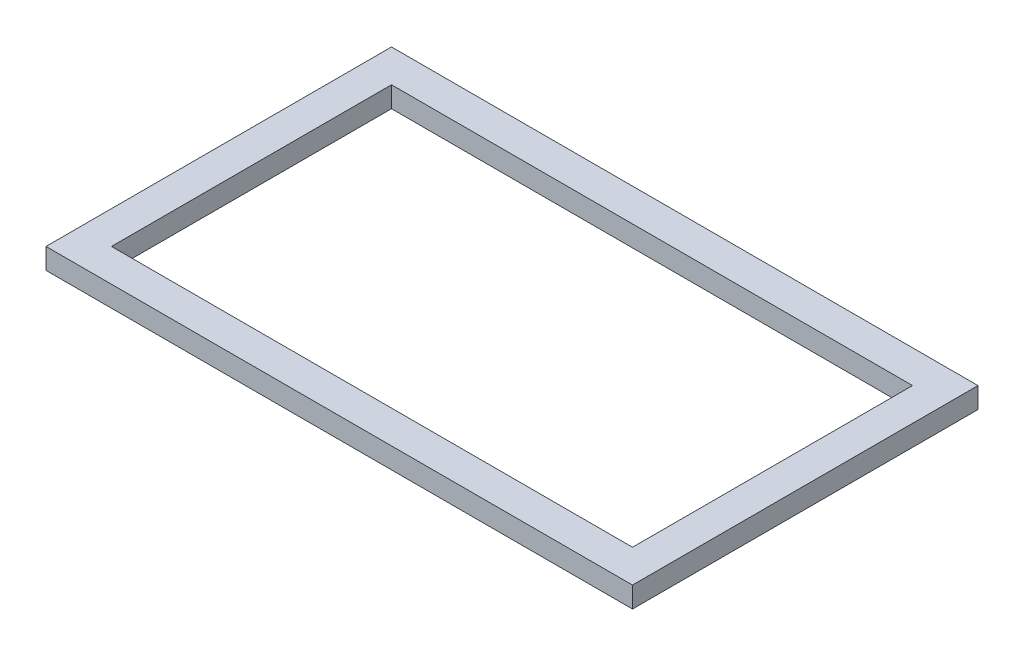
from build123d import *

# Parameters (mm, degrees)
SKETCH1_W           = 358.27
SKETCH1_H           = 211.05
BOSS_EXTRUDE1_DEPTH = 12.7
SKETCH2_W           = 318.27
SKETCH2_H           = 171.05
CUT_EXTRUDE1_DEPTH  = 12.7


with BuildPart() as part:
    # Sketch1 → Boss-Extrude1 (new body)
    with BuildSketch(Plane(origin=(0, 0, 0), x_dir=(1, 0, 0), z_dir=(0, 1, 0))):
        Rectangle(SKETCH1_W, SKETCH1_H)
    extrude(amount=BOSS_EXTRUDE1_DEPTH)

    # Sketch2 → Cut-Extrude1 (cut)
    with BuildSketch(Plane(origin=(0, 12.7, 0), x_dir=(1, 0, 0), z_dir=(0, 1, 0))):
        Rectangle(SKETCH2_W, SKETCH2_H)
    extrude(amount=-CUT_EXTRUDE1_DEPTH, mode=Mode.SUBTRACT)


solid = part.part
